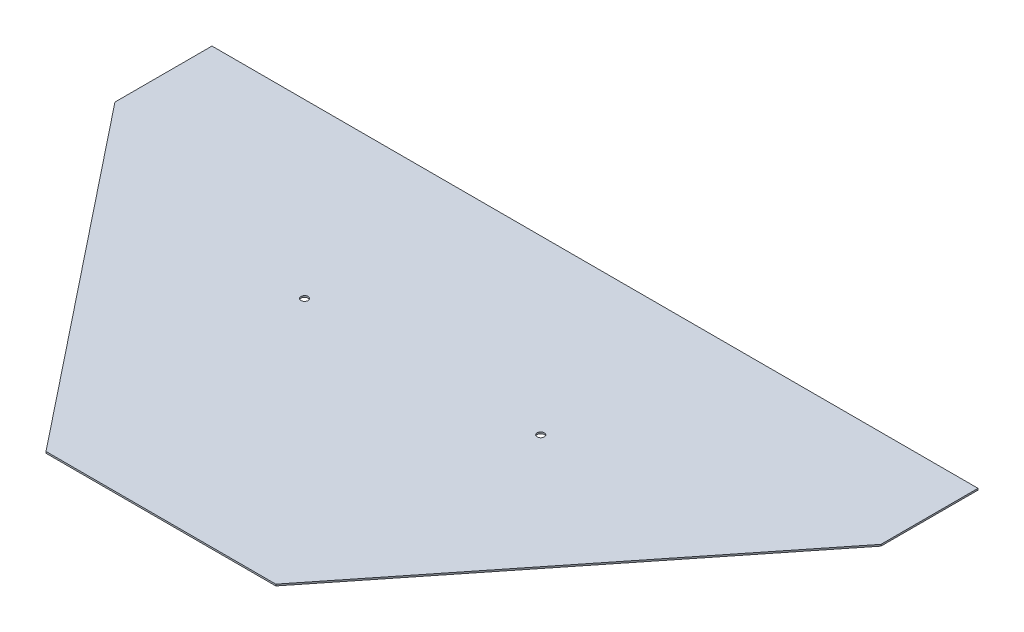
from build123d import *

# Parameters (mm, degrees)
BOSS_EXTRUDE1_DEPTH = 3.175
CUT_EXTRUDE1_REACH  = 1316.193
SKETCH2_R           = 7.14375


with BuildPart() as part:
    # Sketch1 → Boss-Extrude1 (new body)
    with BuildSketch(Plane(origin=(0, 0, 0), x_dir=(1, 0, 0), z_dir=(0, 1, 0))):
        Polygon((0, 0), (457.2, 0), (990.6, 670.56), (990.6, 863.6), (-533.4, 863.6), (-533.4, 670.56), align=None)
    extrude(amount=BOSS_EXTRUDE1_DEPTH)

    # Sketch2 → Cut-Extrude1 (cut, up to next)
    with BuildSketch(Plane(origin=(0, 3.175, 0), x_dir=(1, 0, 0), z_dir=(0, 1, 0)), mode=Mode.PRIVATE) as cut_extrude1_sk1:
        with Locations((-6.35, 520.7)):
            Circle(SKETCH2_R)
    cut_extrude1_tool1 = extrude(cut_extrude1_sk1.sketch, amount=-CUT_EXTRUDE1_REACH, mode=Mode.PRIVATE) & part.part
    # Sketch2 → Cut-Extrude1 (cut, up to next)
    with BuildSketch(Plane(origin=(0, 3.175, 0), x_dir=(1, 0, 0), z_dir=(0, 1, 0)), mode=Mode.PRIVATE) as cut_extrude1_sk2:
        with Locations((463.55, 520.7)):
            Circle(SKETCH2_R)
    cut_extrude1_tool2 = extrude(cut_extrude1_sk2.sketch, amount=-CUT_EXTRUDE1_REACH, mode=Mode.PRIVATE) & part.part
    add(cut_extrude1_tool1.solids().sort_by_distance((-6.35, 3.175, -520.7))[0], mode=Mode.SUBTRACT)
    add(cut_extrude1_tool2.solids().sort_by_distance((463.55, 3.175, -520.7))[0], mode=Mode.SUBTRACT)


solid = part.part
